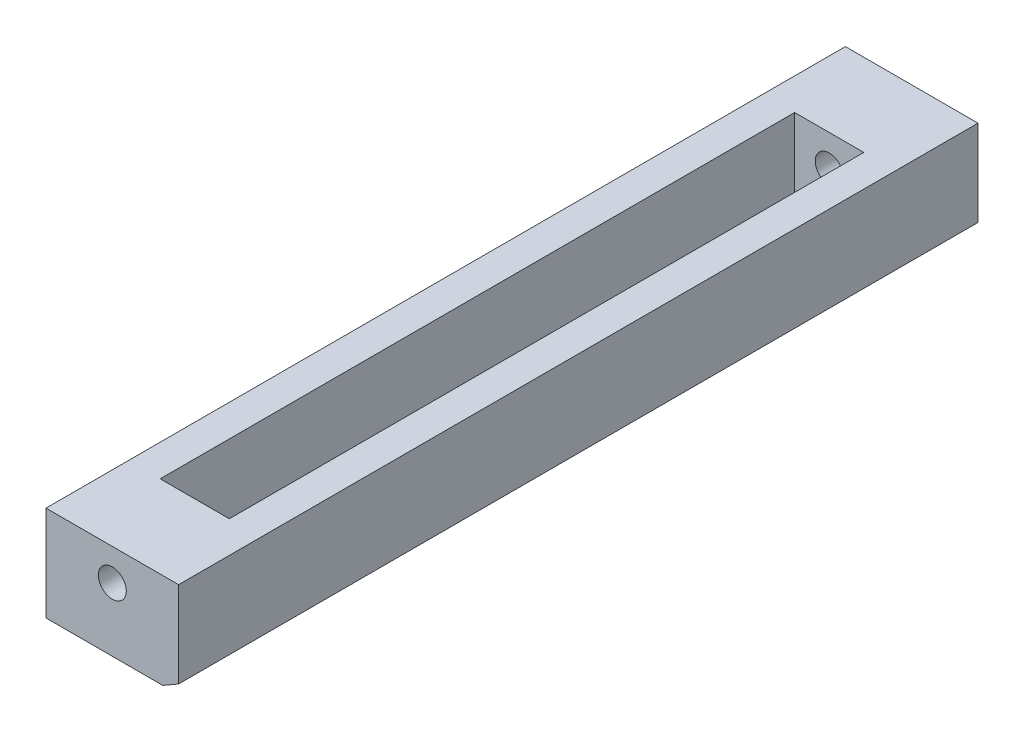
from build123d import *

# Parameters (mm, degrees)
BOSS_EXTRUDE1_DEPTH      = 3.175
BOSS_EXTRUDE1_DEPTH_BACK = 6.35
SKETCH1_W                = 13.2715
SKETCH1_H                = 80.00000002
SKETCH1_W_2              = 6.9215
SKETCH1_H_2              = 63.5
SKETCH4_R                = 1.399999994
CUT_EXTRUDE1_DEPTH       = 81.525497088
CHAMFER1_SIZE            = 1.5875
CHAMFER1_SIZE2           = 0.916543552


with BuildPart() as part:
    # Sketch1 → Boss-Extrude1 (new, two sides: drawn at the far end of the back side and taken through both)
    with BuildSketch(Plane(origin=(0, 0, 0), x_dir=(1, 0, 0), z_dir=(0, 1, 0)).offset(-BOSS_EXTRUDE1_DEPTH_BACK)):
        Rectangle(SKETCH1_W, SKETCH1_H)
        Rectangle(SKETCH1_W_2, SKETCH1_H_2, mode=Mode.SUBTRACT)
    extrude(amount=BOSS_EXTRUDE1_DEPTH + BOSS_EXTRUDE1_DEPTH_BACK)

    # Sketch4 → Cut-Extrude1 (cut, through all)
    with BuildSketch(Plane.XY.offset(40.00000001)):
        Circle(SKETCH4_R)
    extrude(amount=-CUT_EXTRUDE1_DEPTH, mode=Mode.SUBTRACT)

    # Chamfer1
    chamfer1_edges = [part.edges().sort_by_distance(p)[0] for p in [
        (6.63575, -6.35, 0),
    ]]
    chamfer1_side = [part.faces().sort_by_distance(p)[0] for p in [
        (0, -6.35, 39.18906643),
    ]]
    chamfer(chamfer1_edges, length=CHAMFER1_SIZE, length2=CHAMFER1_SIZE2, reference=chamfer1_side[0])


solid = part.part
